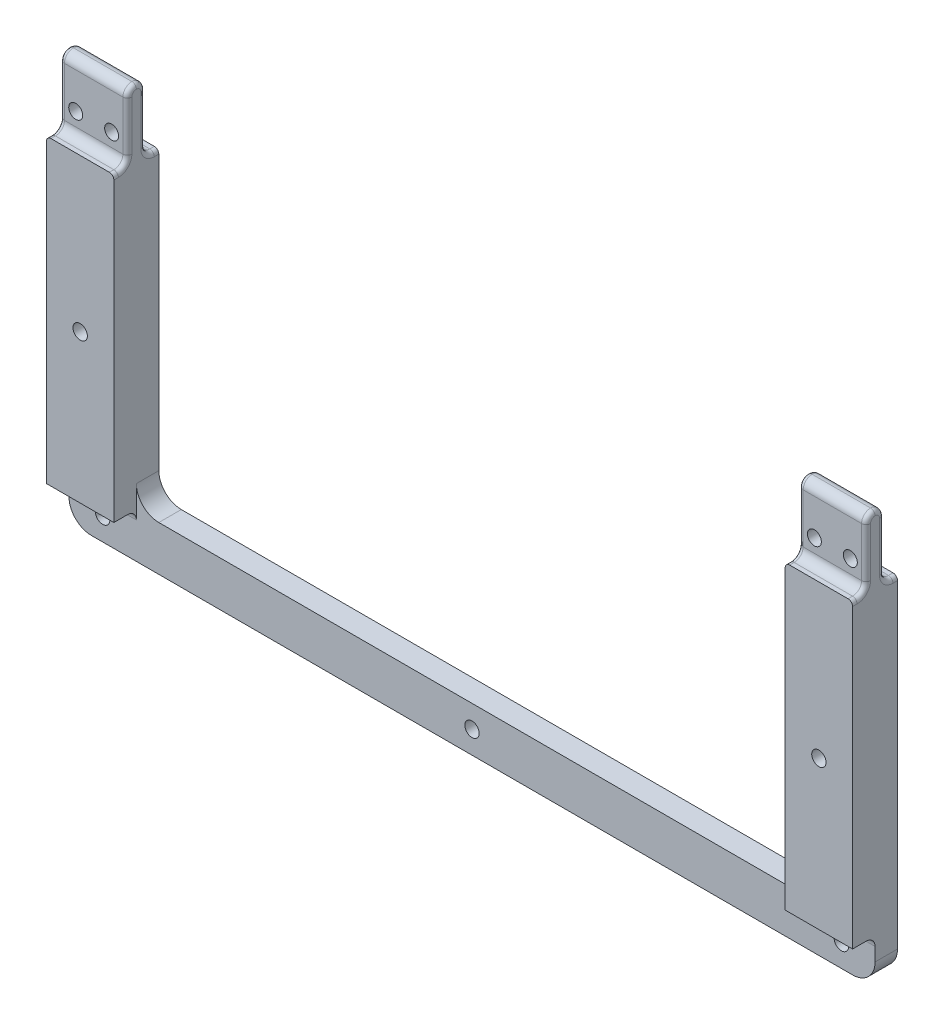
from build123d import *

# Parameters (mm, degrees)
SKETCH1_W            = 15
SKETCH1_H            = 82
BOSS_EXTRUDE1_DEPTH  = 10
SKETCH2_W            = 3
SKETCH2_H            = 15
CUT_EXTRUDE1_DEPTH   = 20
SKETCH3_R            = 1.55
SKETCH3_R_2          = 1.6
CUT_EXTRUDE2_DEPTH   = 10
FILLET1_START        = -17
FILLET1_DEPTH        = 17
FILLET1_START_2      = -15.76142132
FILLET1_2_DEPTH      = 15
FILLET3_R            = 1
SKETCH4_W            = 179.4
SKETCH4_H            = 5
BOSS_EXTRUDE3_DEPTH  = 10
FILLET3_OF_MIRROR3_R = 1
FILLET4_R            = 2
FILLET5_R            = 5
CUT_EXTRUDE3_REACH   = 193.882
SKETCH5_R            = 1.6


with BuildPart() as part:
    # Sketch1 → Boss-Extrude1 (new body)
    with BuildSketch(Plane.XY):
        with Locations((-8.26142132, -14.845177665)):
            Rectangle(SKETCH1_W, SKETCH1_H)
    boss_extrude1 = extrude(amount=BOSS_EXTRUDE1_DEPTH)

    # Sketch2 → Cut-Extrude1 (cut)
    with BuildSketch(Plane(origin=(-0.76142132, 0, 0), x_dir=(0, 0, -1), z_dir=(1, 0, 0))):
        with Locations((-1.5, 18.654822335)):
            Rectangle(SKETCH2_W, SKETCH2_H)
        with Locations((-8.5, 18.654822335)):
            Rectangle(SKETCH2_W, SKETCH2_H)
    cut_extrude1 = extrude(amount=-CUT_EXTRUDE1_DEPTH, mode=Mode.SUBTRACT)

    # Sketch3 → Cut-Extrude2 (cut, symmetric)
    with BuildSketch(Plane(origin=(0, 0, 3), x_dir=(-1, 0, 0), z_dir=(0, 0, -1))):
        with Locations(Location((4.26142132, 16.154822335, 0), (0, 0, 90))):
            Circle(SKETCH3_R)
        with Locations(Location((12.26142132, 16.154822335, 0), (0, 0, 90))):
            Circle(SKETCH3_R)
        with Locations(Location((8.26142132, -22.845177665, 0), (0, 0, 180))):
            Circle(SKETCH3_R_2)
    cut_extrude2 = extrude(amount=CUT_EXTRUDE2_DEPTH, both=True, mode=Mode.SUBTRACT)

    # Fillet1: read off the stored shape, not the designer's step
    # Fillet1 outline → Fillet1 (cut)
    with BuildSketch(Plane.YZ.offset(FILLET1_START)):
        with BuildLine():
            ThreePointArc((24.154822335, 7), (25.569035897, 6.414213562), (26.154822335, 5))
            Line((26.154822335, 5), (26.154822335, 7))
            Line((26.154822335, 7), (24.154822335, 7))
        make_face()
        with BuildLine():
            ThreePointArc((26.154822335, 5), (25.569035897, 3.585786438), (24.154822335, 3))
            Line((24.154822335, 3), (26.154822335, 3))
            Line((26.154822335, 3), (26.154822335, 5))
        make_face()
    fillet1 = extrude(amount=FILLET1_DEPTH, mode=Mode.SUBTRACT)

    # Fillet1 2 outline → Fillet1 2 (add)
    with BuildSketch(Plane.YZ.offset(FILLET1_START_2)):
        with BuildLine():
            Line((11.154822335, 7), (13.154822335, 7))
            ThreePointArc((13.154822335, 7), (11.740608773, 7.585786438), (11.154822335, 9))
            Line((11.154822335, 9), (11.154822335, 7))
        make_face()
        with BuildLine():
            ThreePointArc((11.154822335, 1), (11.740608773, 2.414213562), (13.154822335, 3))
            Line((13.154822335, 3), (11.154822335, 3))
            Line((11.154822335, 3), (11.154822335, 1))
        make_face()
    fillet1_2 = extrude(amount=FILLET1_2_DEPTH)

    # Fillet3
    fillet3_edges = [part.edges().sort_by_distance(p)[0] for p in [
        (-15.76142132, 11.154822335, 9.5),
        (-0.76142132, 11.154822335, 9.5),
        (-0.76142132, 11.154822335, 0.5),
        (-0.76142132, 18.654822335, 3),
        (-0.76142132, 18.654822335, 7),
        (-0.76142132, 25.569035897, 3.585786438),
        (-0.76142132, 25.569035897, 6.414213562),
        (-15.76142132, 18.654822335, 7),
        (-15.76142132, 18.654822335, 3),
        (-15.76142132, 11.154822335, 0.5),
        (-15.76142132, 25.569035897, 3.585786438),
        (-15.76142132, 25.569035897, 6.414213562),
        (-0.76142132, 11.740608773, 2.414213562),
        (-15.76142132, 11.740608773, 2.414213562),
        (-0.76142132, 11.740608773, 7.585786438),
        (-15.76142132, 11.740608773, 7.585786438),
    ]]
    fillet(fillet3_edges, radius=FILLET3_R)

    # Sketch4 → Boss-Extrude3 (add)
    with BuildSketch(Plane.XZ.offset(55.845177665)):
        with Locations((-90.46142132, 2.5)):
            Rectangle(SKETCH4_W, SKETCH4_H)
    extrude(amount=BOSS_EXTRUDE3_DEPTH)

    # Mirror3: Boss-Extrude1, Cut-Extrude1, Cut-Extrude2, Fillet1, Fillet1 2 across plane
    add(boss_extrude1.mirror(Plane.ZY.offset(90.46142132)))
    add(cut_extrude1.mirror(Plane.ZY.offset(90.46142132)), mode=Mode.SUBTRACT)
    add(cut_extrude2.mirror(Plane.ZY.offset(90.46142132)), mode=Mode.SUBTRACT)
    add(fillet1.mirror(Plane.ZY.offset(90.46142132)), mode=Mode.SUBTRACT)
    add(fillet1_2.mirror(Plane.ZY.offset(90.46142132)))

    # Fillet3 of Mirror3
    fillet3_of_mirror3_edges = [part.edges().sort_by_distance(p)[0] for p in [
        (-165.16142132, 11.154822335, 9.5),
        (-180.16142132, 11.154822335, 9.5),
        (-180.16142132, 11.154822335, 0.5),
        (-180.16142132, 18.654822335, 3),
        (-180.16142132, 18.654822335, 7),
        (-180.16142132, 25.569035897, 3.585786438),
        (-180.16142132, 25.569035897, 6.414213562),
        (-165.16142132, 18.654822335, 7),
        (-165.16142132, 18.654822335, 3),
        (-165.16142132, 11.154822335, 0.5),
        (-165.16142132, 25.569035897, 3.585786438),
        (-165.16142132, 25.569035897, 6.414213562),
        (-180.16142132, 11.740608773, 2.414213562),
        (-165.16142132, 11.740608773, 2.414213562),
        (-180.16142132, 11.740608773, 7.585786438),
        (-165.16142132, 11.740608773, 7.585786438),
    ]]
    fillet(fillet3_of_mirror3_edges, radius=FILLET3_OF_MIRROR3_R)

    # Fillet4
    fillet4_edges = [part.edges().sort_by_distance(p)[0] for p in [
        (-8.26142132, -55.845177665, 5),
        (-172.66142132, -55.845177665, 5),
    ]]
    fillet(fillet4_edges, radius=FILLET4_R)

    # Fillet5
    fillet5_edges = [part.edges().sort_by_distance(p)[0] for p in [
        (-15.76142132, -55.845177665, 2.5),
        (-180.16142132, -65.845177665, 2.5),
        (-0.76142132, -65.845177665, 2.5),
        (-165.16142132, -55.845177665, 2.5),
    ]]
    fillet(fillet5_edges, radius=FILLET5_R)

    # Sketch5 → Cut-Extrude3 (cut, up to next)
    with BuildSketch(Plane.XY.offset(5), mode=Mode.PRIVATE) as cut_extrude3_sk1:
        with Locations((-172.66142132, -60.845177665)):
            Circle(SKETCH5_R)
    cut_extrude3_tool1 = extrude(cut_extrude3_sk1.sketch, amount=-CUT_EXTRUDE3_REACH, mode=Mode.PRIVATE) & part.part
    # Sketch5 → Cut-Extrude3 (cut, up to next)
    with BuildSketch(Plane.XY.offset(5), mode=Mode.PRIVATE) as cut_extrude3_sk2:
        with Locations((-90.46142132, -60.845177665)):
            Circle(SKETCH5_R)
    cut_extrude3_tool2 = extrude(cut_extrude3_sk2.sketch, amount=-CUT_EXTRUDE3_REACH, mode=Mode.PRIVATE) & part.part
    # Sketch5 → Cut-Extrude3 (cut, up to next)
    with BuildSketch(Plane.XY.offset(5), mode=Mode.PRIVATE) as cut_extrude3_sk3:
        with Locations((-8.26142132, -60.845177665)):
            Circle(SKETCH5_R)
    cut_extrude3_tool3 = extrude(cut_extrude3_sk3.sketch, amount=-CUT_EXTRUDE3_REACH, mode=Mode.PRIVATE) & part.part
    add(cut_extrude3_tool1.solids().sort_by_distance((-172.661421, -60.845178, 5))[0], mode=Mode.SUBTRACT)
    add(cut_extrude3_tool2.solids().sort_by_distance((-90.461421, -60.845178, 5))[0], mode=Mode.SUBTRACT)
    add(cut_extrude3_tool3.solids().sort_by_distance((-8.261421, -60.845178, 5))[0], mode=Mode.SUBTRACT)


solid = part.part
